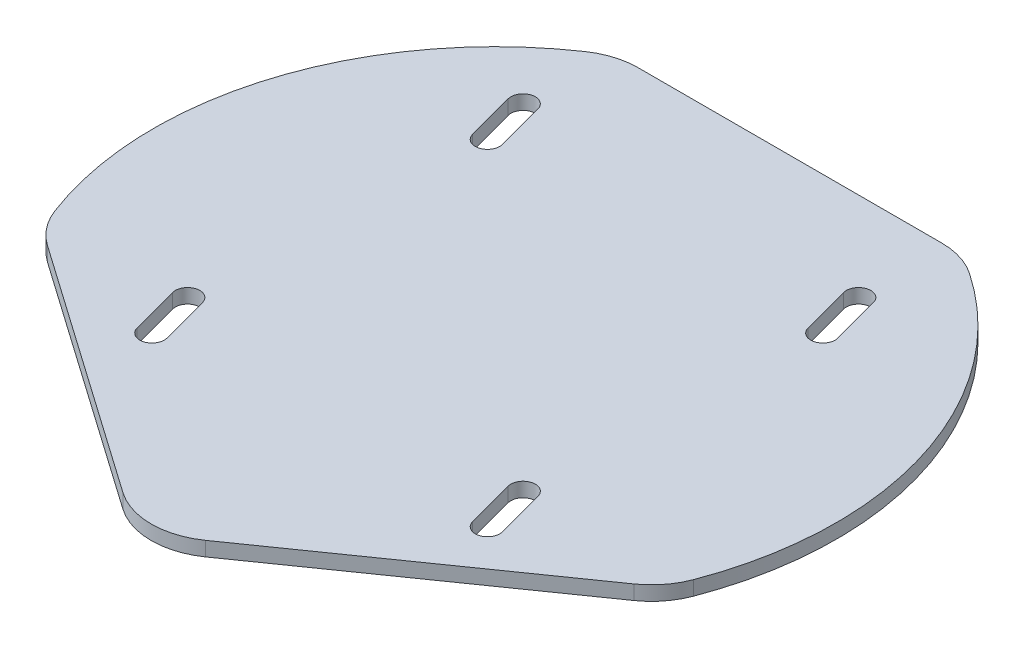
from build123d import *

# Parameters (mm, degrees)
BOSS_EXTRUDE1_DEPTH     = 2
ENL_V_MAT_EXTRU_1_REACH = 71.032
CONG_1_R                = 10


with BuildPart() as part:
    # Sketch1 → Boss-Extrude1 (new body)
    with BuildSketch(Plane(origin=(0, 0, 0), x_dir=(1, 0, 0), z_dir=(0, 1, 0))):
        with BuildLine():
            ThreePointArc((-23.98436991, 41), (-45.301555161, 14.283525476), (-43.163479533, -19.828364395))
            Line((-43.163479533, -19.828364395), (0, -50.051758139))
            Line((0, -50.051758139), (43.163479533, -19.828364395))
            ThreePointArc((43.163479533, -19.828364395), (45.301555161, 14.283525476), (23.98436991, 41))
            Line((23.98436991, 41), (-23.98436991, 41))
        make_face()
    extrude(amount=BOSS_EXTRUDE1_DEPTH)

    # Esquisse1 → Enlèv. mat.-Extru.1 (cut, up to next)
    with BuildSketch(Plane(origin=(0, 2, 0), x_dir=(1, 0, 0), z_dir=(0, 1, 0)), mode=Mode.PRIVATE) as enl_v_mat_extru_1_sk1:
        with BuildLine():
            Line((-23.115954623, 29.0871082), (-21.304221307, 22.325627416))
            ThreePointArc((-21.304221307, 22.325627416), (-22.506302835, 20.243561135), (-24.588369116, 21.445642663))
            Line((-24.588369116, 21.445642663), (-26.400102432, 28.207123447))
            ThreePointArc((-26.400102432, 28.207123447), (-25.198020904, 30.289189728), (-23.115954623, 29.0871082))
        make_face()
    enl_v_mat_extru_1_tool1 = extrude(enl_v_mat_extru_1_sk1.sketch, amount=-ENL_V_MAT_EXTRU_1_REACH, mode=Mode.PRIVATE) & part.part
    # Esquisse1 → Enlèv. mat.-Extru.1 (cut, up to next)
    with BuildSketch(Plane(origin=(0, 2, 0), x_dir=(1, 0, 0), z_dir=(0, 1, 0)), mode=Mode.PRIVATE) as enl_v_mat_extru_1_sk2:
        with BuildLine():
            Line((22.080678442, 21.445642663), (20.268945126, 28.207123447))
            ThreePointArc((20.268945126, 28.207123447), (21.471026654, 30.289189728), (23.553092936, 29.0871082))
            Line((23.553092936, 29.0871082), (25.364826252, 22.325627416))
            ThreePointArc((25.364826252, 22.325627416), (24.162744723, 20.243561135), (22.080678442, 21.445642663))
        make_face()
    enl_v_mat_extru_1_tool2 = extrude(enl_v_mat_extru_1_sk2.sketch, amount=-ENL_V_MAT_EXTRU_1_REACH, mode=Mode.PRIVATE) & part.part
    # Esquisse1 → Enlèv. mat.-Extru.1 (cut, up to next)
    with BuildSketch(Plane(origin=(0, 2, 0), x_dir=(1, 0, 0), z_dir=(0, 1, 0)), mode=Mode.PRIVATE) as enl_v_mat_extru_1_sk3:
        with BuildLine():
            Line((22.080678442, -25.223404895), (20.268945126, -18.461924111))
            ThreePointArc((20.268945126, -18.461924111), (21.471026654, -16.37985783), (23.553092936, -17.581939358))
            Line((23.553092936, -17.581939358), (25.364826252, -24.343420142))
            ThreePointArc((25.364826252, -24.343420142), (24.162744723, -26.425486423), (22.080678442, -25.223404895))
        make_face()
    enl_v_mat_extru_1_tool3 = extrude(enl_v_mat_extru_1_sk3.sketch, amount=-ENL_V_MAT_EXTRU_1_REACH, mode=Mode.PRIVATE) & part.part
    # Esquisse1 → Enlèv. mat.-Extru.1 (cut, up to next)
    with BuildSketch(Plane(origin=(0, 2, 0), x_dir=(1, 0, 0), z_dir=(0, 1, 0)), mode=Mode.PRIVATE) as enl_v_mat_extru_1_sk4:
        with BuildLine():
            Line((-24.588369116, -25.223404895), (-26.400102432, -18.461924111))
            ThreePointArc((-26.400102432, -18.461924111), (-25.198020904, -16.37985783), (-23.115954623, -17.581939358))
            Line((-23.115954623, -17.581939358), (-21.304221307, -24.343420142))
            ThreePointArc((-21.304221307, -24.343420142), (-22.506302835, -26.425486423), (-24.588369116, -25.223404895))
        make_face()
    enl_v_mat_extru_1_tool4 = extrude(enl_v_mat_extru_1_sk4.sketch, amount=-ENL_V_MAT_EXTRU_1_REACH, mode=Mode.PRIVATE) & part.part
    add(enl_v_mat_extru_1_tool1.solids().sort_by_distance((-23.852162, 2, -25.266375))[0], mode=Mode.SUBTRACT)
    add(enl_v_mat_extru_1_tool2.solids().sort_by_distance((22.816886, 2, -25.266375))[0], mode=Mode.SUBTRACT)
    add(enl_v_mat_extru_1_tool3.solids().sort_by_distance((22.816886, 2, 21.402672))[0], mode=Mode.SUBTRACT)
    add(enl_v_mat_extru_1_tool4.solids().sort_by_distance((-23.852162, 2, 21.402672))[0], mode=Mode.SUBTRACT)

    # Congé1
    cong_1_edges = [part.edges().sort_by_distance(p)[0] for p in [
        (43.163479533, 1, 19.828364395),
        (23.98436991, 1, -41),
        (-23.98436991, 1, -41),
        (-43.163479533, 1, 19.828364395),
        (0, 1, 50.051758139),
    ]]
    fillet(cong_1_edges, radius=CONG_1_R)


solid = part.part
